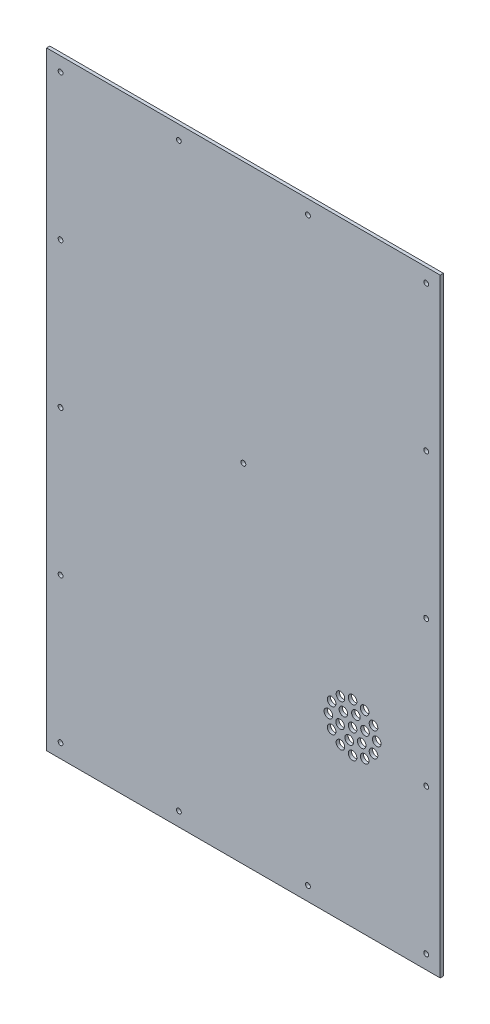
from build123d import *

# Parameters (mm, degrees)
SKETCH_1_W          = 366
SKETCH_1_H          = 566
EXTRUDE_1_DEPTH     = 3
SKETCH_5_R          = 2.25
CUT_EXTRUDE_2_DEPTH = 675.033381963
SKETCH1_R           = 2.25
CUT_EXTRUDE1_DEPTH  = 675.033381963
SKETCH_6_R          = 4
CUT_EXTRUDE_3_DEPTH = 675.033381963


with BuildPart() as part:
    # Эскиз1 → Бобышка-Вытянуть1 (new body)
    with BuildSketch(Plane.XY):
        with Locations((183, 283)):
            Rectangle(SKETCH_1_W, SKETCH_1_H)
    extrude(amount=EXTRUDE_1_DEPTH)

    # Эскиз5 → Вырез-Вытянуть2 (cut, through all)
    with BuildSketch(Plane(origin=(0, 0, 0), x_dir=(-1, 0, 0), z_dir=(0, 0, -1))):
        with Locations((-353, 553)):
            Circle(SKETCH_5_R)
        with Locations((-13, 553)):
            Circle(SKETCH_5_R)
        with Locations((-243, 553)):
            Circle(SKETCH_5_R)
        with Locations((-123, 553)):
            Circle(SKETCH_5_R)
        with Locations((-353, 418)):
            Circle(SKETCH_5_R)
        with Locations((-353, 283)):
            Circle(SKETCH_5_R)
        with Locations((-353, 148)):
            Circle(SKETCH_5_R)
        with Locations((-353, 13)):
            Circle(SKETCH_5_R)
        with Locations((-123, 13)):
            Circle(SKETCH_5_R)
        with Locations((-243, 13)):
            Circle(SKETCH_5_R)
        with Locations((-13, 418)):
            Circle(SKETCH_5_R)
        with Locations((-13, 283)):
            Circle(SKETCH_5_R)
        with Locations((-13, 148)):
            Circle(SKETCH_5_R)
        with Locations((-13, 13)):
            Circle(SKETCH_5_R)
    extrude(amount=-CUT_EXTRUDE_2_DEPTH, mode=Mode.SUBTRACT)

    # Sketch1 → Cut-Extrude1 (cut, through all)
    with BuildSketch(Plane.XY.offset(3)):
        with Locations((183, 323)):
            Circle(SKETCH1_R)
    extrude(amount=-CUT_EXTRUDE1_DEPTH, mode=Mode.SUBTRACT)

    # Эскиз6 → Вырез-Вытянуть3 (cut, through all)
    with BuildSketch(Plane(origin=(0, 0, 0), x_dir=(-1, 0, 0), z_dir=(0, 0, -1))):
        with Locations((-284.5, 138.5)):
            Circle(SKETCH_6_R)
        with Locations((-295.75, 141.514428415)):
            Circle(SKETCH_6_R)
        with Locations((-303.985571585, 149.75)):
            Circle(SKETCH_6_R)
        with Locations((-307, 161)):
            Circle(SKETCH_6_R)
        with Locations((-303.985571585, 172.25)):
            Circle(SKETCH_6_R)
        with Locations((-295.75, 180.485571585)):
            Circle(SKETCH_6_R)
        with Locations((-284.5, 183.5)):
            Circle(SKETCH_6_R)
        with Locations((-273.25, 180.485571585)):
            Circle(SKETCH_6_R)
        with Locations((-265.014428415, 172.25)):
            Circle(SKETCH_6_R)
        with Locations((-262, 161)):
            Circle(SKETCH_6_R)
        with Locations((-265.014428415, 149.75)):
            Circle(SKETCH_6_R)
        with Locations((-273.25, 141.514428415)):
            Circle(SKETCH_6_R)
        with Locations((-292.985281374, 152.514718626)):
            Circle(SKETCH_6_R)
        with Locations((-296.091109915, 164.105828541)):
            Circle(SKETCH_6_R)
        with Locations((-287.605828541, 172.591109915)):
            Circle(SKETCH_6_R)
        with Locations((-276.014718626, 169.485281374)):
            Circle(SKETCH_6_R)
        with Locations((-272.908890085, 157.894171459)):
            Circle(SKETCH_6_R)
        with Locations((-281.394171459, 149.408890085)):
            Circle(SKETCH_6_R)
        with Locations((-284.5, 161)):
            Circle(SKETCH_6_R)
    extrude(amount=-CUT_EXTRUDE_3_DEPTH, mode=Mode.SUBTRACT)


solid = part.part
